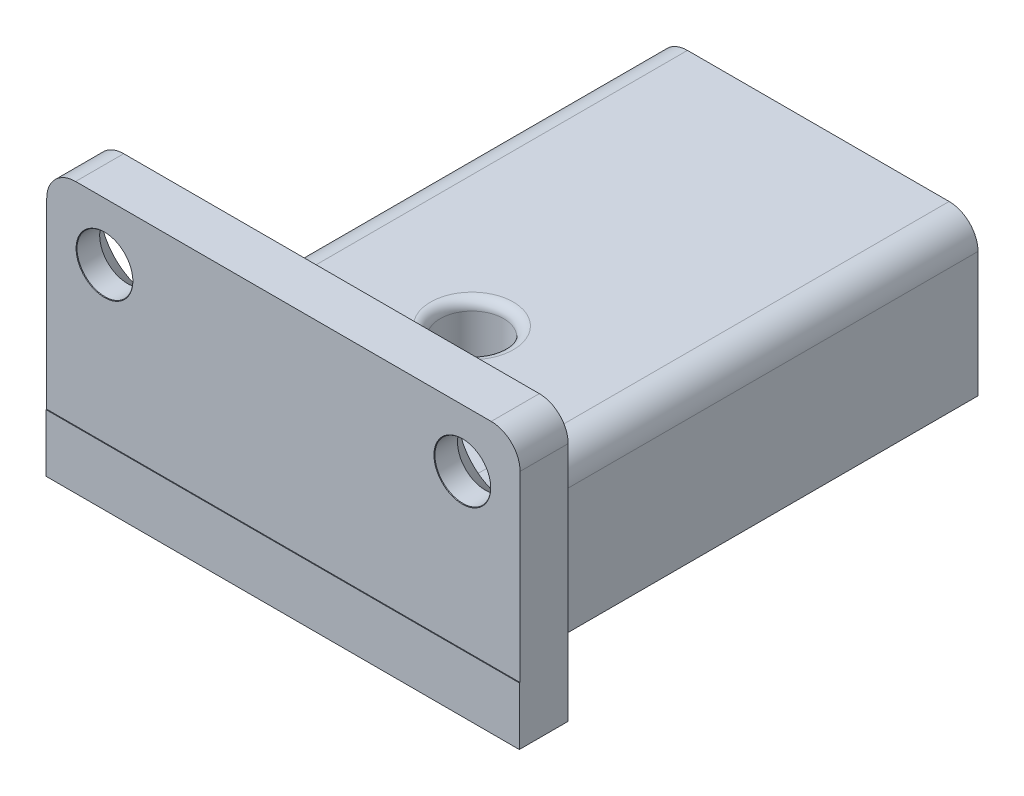
from build123d import *

# Parameters (mm, degrees)
ESQUISSE1_W                                  = 12.6
ESQUISSE1_H                                  = 12.8
ESQUISSE1_R                                  = 1.65
BOSS_EXTRU_1_DEPTH                           = 5
BOSS_EXTRU_3_DEPTH                           = 6
BOSS_EXTRU_3_DEPTH_BACK                      = 5
ESQUISSE2_W                                  = 24.6
ESQUISSE2_H                                  = 2.5
FRAISAGE_POUR_VIS_T_TE_FRAIS_E_M2_51_A_COUNT = 2
FRAISAGE_POUR_VIS_T_TE_FRAIS_E_M2_51_A_PITCH = 18.6
CONG_3_R                                     = 0.5
ESQUISSE6_W                                  = 12.6
ESQUISSE6_H                                  = 3
BOSS_EXTRU_4_DEPTH                           = 10
ESQUISSE7_W                                  = 12.6
ESQUISSE7_H                                  = 5
BOSS_EXTRU_5_DEPTH                           = 5
ESQUISSE9_W                                  = 24.6
ESQUISSE9_H                                  = 2.538668555
BOSS_EXTRU_6_DEPTH                           = 3
ESQUISSE11_W                                 = 2
ESQUISSE11_H                                 = 8
BOSS_EXTRU_7_DEPTH                           = 25.3
CONG_4_R                                     = 1
CONG_5_R                                     = 1
CONG_6_R                                     = 1.5
CONG_7_R                                     = 1.5


with BuildPart() as part:
    # Esquisse1 → Boss.-Extru.1 (new body)
    with BuildSketch(Plane(origin=(0, 0, 0), x_dir=(1, 0, 0), z_dir=(0, 1, 0))):
        with Locations((0, -1.438202247)):
            Rectangle(ESQUISSE1_W, ESQUISSE1_H)
        with Locations(Location((0, 1.961797753, 0), (0, 0, 270))):
            Circle(ESQUISSE1_R, mode=Mode.SUBTRACT)
    extrude(amount=BOSS_EXTRU_1_DEPTH)

    # Esquisse2 → Boss.-Extru.3 (add, two sides: drawn at the far end of the back side and taken through both)
    with BuildSketch(Plane(origin=(0, 5, 0), x_dir=(1, 0, 0), z_dir=(0, 1, 0)).offset(-BOSS_EXTRU_3_DEPTH_BACK)):
        with Locations((0, -6.588202247)):
            Rectangle(ESQUISSE2_W, ESQUISSE2_H)
    extrude(amount=BOSS_EXTRU_3_DEPTH + BOSS_EXTRU_3_DEPTH_BACK)

    # Esquisse5 → Fraisage pour vis à tête fraisée M2.51 (revolve, cut)
    with BuildSketch(Plane(origin=(-9.3, 8, 5.338202247), x_dir=(0, 1, 0), z_dir=(1, 0, 0))):
        Polygon((0, 0), (0, 2.5), (1.475, 2.5), (1.45, 2.475), (1.45, 1.3), (2.75, 0), align=None)
    fraisage_pour_vis_t_te_frais_e_m2_51 = revolve(axis=Axis((-9.3, 8, -1.011797753), (0, 0, 1)), mode=Mode.SUBTRACT)

    # Fraisage pour vis à tête fraisée M2.51 a: Fraisage pour vis à tête fraisée M2.51 ×2
    with Locations(*[(i * FRAISAGE_POUR_VIS_T_TE_FRAIS_E_M2_51_A_PITCH, 0, 0) for i in range(1, FRAISAGE_POUR_VIS_T_TE_FRAIS_E_M2_51_A_COUNT)]):
        add(fraisage_pour_vis_t_te_frais_e_m2_51, mode=Mode.SUBTRACT)

    # Congé3
    cong_3_edges = [part.edges().sort_by_distance(p)[0] for p in [
        (0, 0, -3.611797753),
        (0, 5, -3.611797753),
    ]]
    fillet(cong_3_edges, radius=CONG_3_R)

    # Esquisse6 → Boss.-Extru.4 (add)
    with BuildSketch(Plane(origin=(0, 0, -4.961797753), x_dir=(-1, 0, 0), z_dir=(0, 0, -1))):
        with Locations((0, 3.5)):
            Rectangle(ESQUISSE6_W, ESQUISSE6_H)
    extrude(amount=BOSS_EXTRU_4_DEPTH)

    # Esquisse7 → Boss.-Extru.5 (add)
    with BuildSketch(Plane(origin=(0, 0, -14.961797753), x_dir=(-1, 0, 0), z_dir=(0, 0, -1))):
        with Locations((0, 2.5)):
            Rectangle(ESQUISSE7_W, ESQUISSE7_H)
    extrude(amount=BOSS_EXTRU_5_DEPTH)

    # Esquisse9 → Boss.-Extru.6 (add)
    with BuildSketch(Plane.XZ):
        with Locations((0, 6.607536525)):
            Rectangle(ESQUISSE9_W, ESQUISSE9_H)
    extrude(amount=BOSS_EXTRU_6_DEPTH)

    # Esquisse11 → Boss.-Extru.7 (add)
    with BuildSketch(Plane(origin=(0, 0, 5.338202247), x_dir=(-1, 0, 0), z_dir=(0, 0, -1))):
        with Locations((-7.3, 1)):
            Rectangle(ESQUISSE11_W, ESQUISSE11_H)
        with Locations((7.3, 1)):
            Rectangle(ESQUISSE11_W, ESQUISSE11_H)
    extrude(amount=BOSS_EXTRU_7_DEPTH)

    # Congé4
    cong_4_edges = [part.edges().sort_by_distance(p)[0] for p in [
        (0, 0, -14.961797753),
        (0, 2, -14.961797753),
        (0, 2, -4.961797753),
    ]]
    fillet(cong_4_edges, radius=CONG_4_R - 0.0001)  # a hair under: the kernel refuses the full size

    # Congé5
    cong_5_edges = [part.edges().sort_by_distance(p)[0] for p in [
        (6.3, -3, -7.311797753),
        (-6.3, -3, -7.311797753),
    ]]
    fillet(cong_5_edges, radius=CONG_5_R)

    # Congé6
    cong_6_edges = [part.edges().sort_by_distance(p)[0] for p in [
        (8.3, 5, -7.311797753),
        (-8.3, 5, -7.311797753),
    ]]
    fillet(cong_6_edges, radius=CONG_6_R)

    # Congé7
    cong_7_edges = [part.edges().sort_by_distance(p)[0] for p in [
        (-12.3, 11, 6.588202247),
        (12.3, 11, 6.588202247),
    ]]
    fillet(cong_7_edges, radius=CONG_7_R)


solid = part.part
